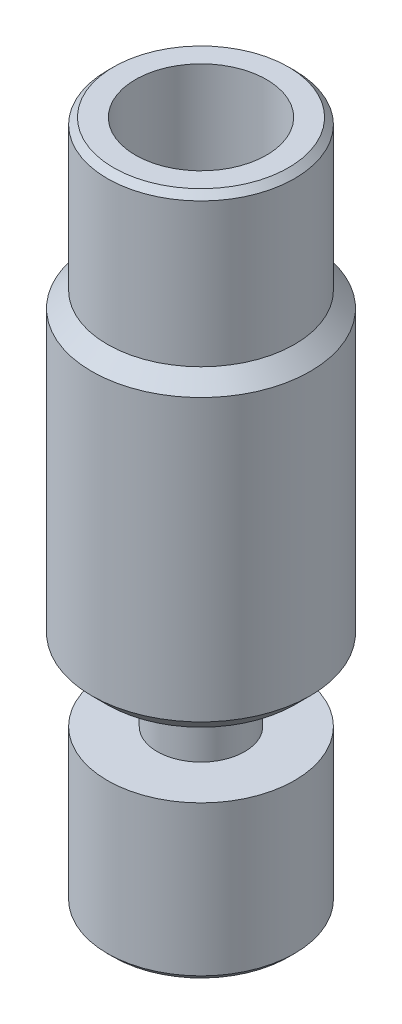
from build123d import *

# Parameters (mm, degrees)
HOLE_WIZARD_1_D     = 4.2
HOLE_WIZARD_1_DEPTH = 4.8
HOLE_WIZARD_1_TIP   = 1.2618073
CHAMFER_1_SIZE      = 0.2
CHAMFER_2_SIZE      = 0.5


with BuildPart() as part:
    # Эскиз1 → Повернуть1 (revolve)
    with BuildSketch(Plane(origin=(0, 0, 0), x_dir=(0, 0, -1), z_dir=(1, 0, 0)), mode=Mode.PRIVATE) as revolve_1_sk:
        Polygon((-1, 21.9), (-1, 0), (-3, 0), (-3, 5), (-1.4, 5), (-1.4, 7.1), (-3.5, 7.1), (-3.5, 17.1), (-3, 17.1), (-3, 21.9), align=None)
    revolve(revolve_1_sk.sketch.rotate(Axis((0, 0, 0), (0, 1, 0)), 180), axis=Axis((0, 0, 0), (0, 1, 0)))

    # Отверстие1
    with Locations(Plane(origin=(0, 21.9, 0), x_dir=(-1, 0, 0), z_dir=(0, 1, 0))):
        with Locations((0, 0)):
            Hole(HOLE_WIZARD_1_D / 2, depth=HOLE_WIZARD_1_DEPTH)
            with Locations((0, 0, -(HOLE_WIZARD_1_DEPTH + HOLE_WIZARD_1_TIP / 2))):  # 118° drill point
                Cone(0, HOLE_WIZARD_1_D / 2, HOLE_WIZARD_1_TIP, mode=Mode.SUBTRACT)

    # Фаска1
    chamfer_1_edges = [part.edges().sort_by_distance(p)[0] for p in [
        (0, 0, 3),
        (0, 21.9, 3),
    ]]
    chamfer(chamfer_1_edges, length=CHAMFER_1_SIZE)

    # Фаска2
    chamfer_2_edges = [part.edges().sort_by_distance(p)[0] for p in [
        (0, 17.1, 3.5),
        (0, 7.1, 3.5),
    ]]
    chamfer(chamfer_2_edges, length=CHAMFER_2_SIZE - 0.0001)  # a hair under: the kernel refuses the full size


solid = part.part
